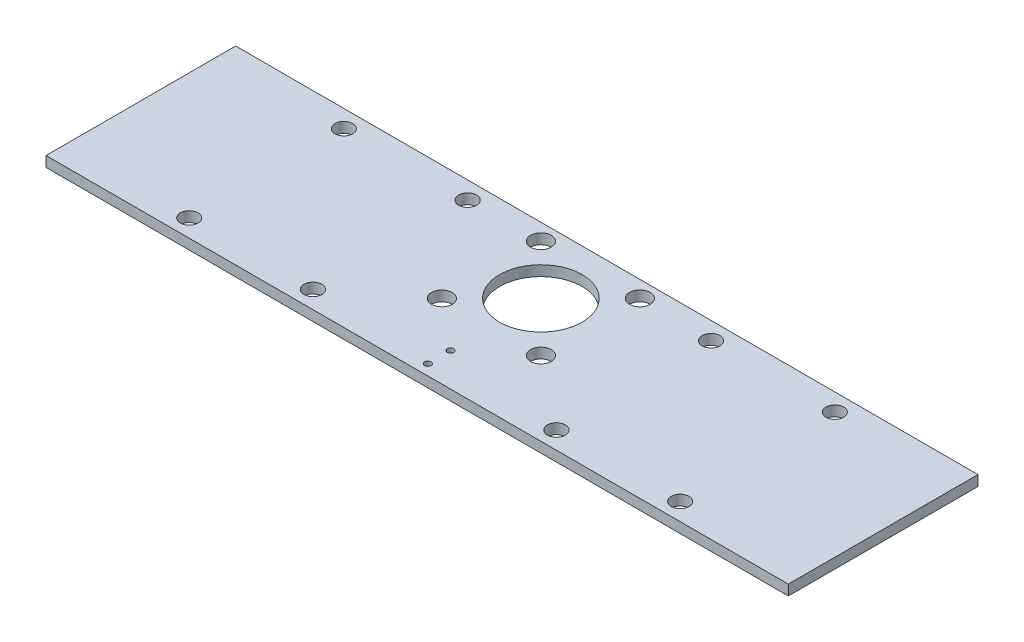
from build123d import *

# Parameters (mm, degrees)
SKETCH1_W                  = 457.2
SKETCH1_H                  = 116.84
BOSS_EXTRUDE1_DEPTH        = 3.175
F_1_1_DIAMETER_HOLE1_D     = 50.8
F_1_2_0_5_DIAMETER_HOLE1_D = 12.7
F_4_0_4_DIAMETER_HOLE1_D   = 4
M10_CLEARANCE_HOLE1_D      = 11
AUX_CLEARANCE_HOLES_REACH  = 243.049
SKETCH11_R                 = 5.461


with BuildPart() as part:
    # Sketch1 → Boss-Extrude1 (new, symmetric)
    with BuildSketch(Plane(origin=(0, 0, 0), x_dir=(1, 0, 0), z_dir=(0, 1, 0))):
        with Locations((0, -17.78)):
            Rectangle(SKETCH1_W, SKETCH1_H)
    extrude(amount=BOSS_EXTRUDE1_DEPTH, both=True)

    # 1 (1) Diameter Hole1 (through all)
    with Locations(Plane(origin=(0, 3.175, 0), x_dir=(1, 0, 0), z_dir=(0, 1, 0))):
        with Locations((0, 0)):
            Hole(F_1_1_DIAMETER_HOLE1_D / 2)

    # 1/2 (0.5) Diameter Hole1 (through all)
    with Locations(Plane(origin=(0, 3.175, 0), x_dir=(1, 0, 0), z_dir=(0, 1, 0))):
        with Locations((30.48, -30.48), (-30.48, 30.48), (-30.48, -30.48), (30.48, 30.48)):
            Hole(F_1_2_0_5_DIAMETER_HOLE1_D / 2)

    # Ø4.0 (4) Diameter Hole1 (through all)
    with Locations(Plane(origin=(0, 3.175, 0), x_dir=(1, 0, 0), z_dir=(0, 1, 0))):
        with Locations((0, -55.63), (0, -69.63)):
            Hole(F_4_0_4_DIAMETER_HOLE1_D / 2)

    # M10 Clearance Hole1 (through all)
    with Locations(Plane(origin=(0, 3.175, 0), x_dir=(1, 0, 0), z_dir=(0, 1, 0))):
        with Locations((75, -65.405), (-75, 29.845), (-75, -65.405), (75, 29.845)):
            Hole(M10_CLEARANCE_HOLE1_D / 2)

    # Sketch11 → Aux Clearance holes (cut, up to next)
    with BuildSketch(Plane(origin=(0, 3.175, 0), x_dir=(1, 0, 0), z_dir=(0, 1, 0)), mode=Mode.PRIVATE) as aux_clearance_holes_sk1:
        with Locations((-151.2, 29.845)):
            Circle(SKETCH11_R)
    aux_clearance_holes_tool1 = extrude(aux_clearance_holes_sk1.sketch, amount=-AUX_CLEARANCE_HOLES_REACH, mode=Mode.PRIVATE) & part.part
    # Sketch11 → Aux Clearance holes (cut, up to next)
    with BuildSketch(Plane(origin=(0, 3.175, 0), x_dir=(1, 0, 0), z_dir=(0, 1, 0)), mode=Mode.PRIVATE) as aux_clearance_holes_sk2:
        with Locations((-151.2, -65.405)):
            Circle(SKETCH11_R)
    aux_clearance_holes_tool2 = extrude(aux_clearance_holes_sk2.sketch, amount=-AUX_CLEARANCE_HOLES_REACH, mode=Mode.PRIVATE) & part.part
    # Sketch11 → Aux Clearance holes (cut, up to next)
    with BuildSketch(Plane(origin=(0, 3.175, 0), x_dir=(1, 0, 0), z_dir=(0, 1, 0)), mode=Mode.PRIVATE) as aux_clearance_holes_sk3:
        with Locations((151.2, 29.845)):
            Circle(SKETCH11_R)
    aux_clearance_holes_tool3 = extrude(aux_clearance_holes_sk3.sketch, amount=-AUX_CLEARANCE_HOLES_REACH, mode=Mode.PRIVATE) & part.part
    # Sketch11 → Aux Clearance holes (cut, up to next)
    with BuildSketch(Plane(origin=(0, 3.175, 0), x_dir=(1, 0, 0), z_dir=(0, 1, 0)), mode=Mode.PRIVATE) as aux_clearance_holes_sk4:
        with Locations((151.2, -65.405)):
            Circle(SKETCH11_R)
    aux_clearance_holes_tool4 = extrude(aux_clearance_holes_sk4.sketch, amount=-AUX_CLEARANCE_HOLES_REACH, mode=Mode.PRIVATE) & part.part
    add(aux_clearance_holes_tool1.solids().sort_by_distance((-151.2, 3.175, -29.845))[0], mode=Mode.SUBTRACT)
    add(aux_clearance_holes_tool2.solids().sort_by_distance((-151.2, 3.175, 65.405))[0], mode=Mode.SUBTRACT)
    add(aux_clearance_holes_tool3.solids().sort_by_distance((151.2, 3.175, -29.845))[0], mode=Mode.SUBTRACT)
    add(aux_clearance_holes_tool4.solids().sort_by_distance((151.2, 3.175, 65.405))[0], mode=Mode.SUBTRACT)


solid = part.part
